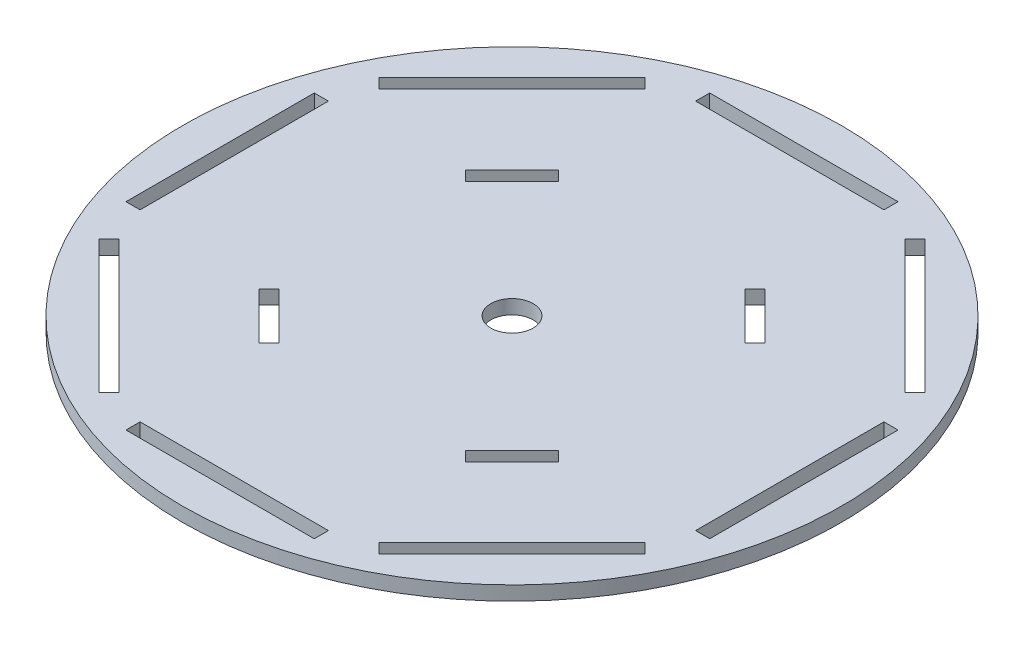
from build123d import *

# Parameters (mm, degrees)
CROQUIS1_R              = 70
CROQUIS1_R_2            = 4.5
SALIENTE_EXTRUIR1_DEPTH = 3


with BuildPart() as part:
    # Croquis1 → Saliente-Extruir1 (new body)
    with BuildSketch(Plane(origin=(0, 0, 0), x_dir=(1, 0, 0), z_dir=(0, 1, 0))):
        Circle(CROQUIS1_R)
        Circle(CROQUIS1_R_2, mode=Mode.SUBTRACT)
        Polygon((24.748737342, 24.748737342), (29.69848481, 19.798989873), (31.819805153, 21.920310217), (21.920310217, 31.819805153), (19.798989873, 29.69848481), align=None, mode=Mode.SUBTRACT)
        Polygon((24.748737342, -24.748737342), (19.798989873, -29.69848481), (21.920310217, -31.819805153), (31.819805153, -21.920310217), (29.69848481, -19.798989873), align=None, mode=Mode.SUBTRACT)
        Polygon((-24.748737342, 24.748737342), (-19.798989873, 29.69848481), (-21.920310217, 31.819805153), (-31.819805153, 21.920310217), (-29.69848481, 19.798989873), align=None, mode=Mode.SUBTRACT)
        Polygon((-24.748737342, -24.748737342), (-29.69848481, -19.798989873), (-31.819805153, -21.920310217), (-21.920310217, -31.819805153), (-19.798989873, -29.69848481), align=None, mode=Mode.SUBTRACT)
        Polygon((0, 62), (20, 62), (20, 59), (-20, 59), (-20, 62), align=None, mode=Mode.SUBTRACT)
        Polygon((55.861435714, 27.577164466), (27.577164466, 55.861435714), (29.69848481, 57.982756057), (43.840620434, 43.840620434), (57.982756057, 29.69848481), align=None, mode=Mode.SUBTRACT)
        Polygon((59, -20), (59, 20), (62, 20), (62, 0), (62, -20), align=None, mode=Mode.SUBTRACT)
        Polygon((27.577164466, -55.861435714), (55.861435714, -27.577164466), (57.982756057, -29.69848481), (43.840620434, -43.840620434), (29.69848481, -57.982756057), align=None, mode=Mode.SUBTRACT)
        Polygon((-20, -59), (20, -59), (20, -62), (0, -62), (-20, -62), align=None, mode=Mode.SUBTRACT)
        Polygon((-55.861435714, -27.577164466), (-27.577164466, -55.861435714), (-29.69848481, -57.982756057), (-43.840620434, -43.840620434), (-57.982756057, -29.69848481), align=None, mode=Mode.SUBTRACT)
        Polygon((-59, 20), (-59, -20), (-62, -20), (-62, 0), (-62, 20), align=None, mode=Mode.SUBTRACT)
        Polygon((-27.577164466, 55.861435714), (-55.861435714, 27.577164466), (-57.982756057, 29.69848481), (-43.840620434, 43.840620434), (-29.69848481, 57.982756057), align=None, mode=Mode.SUBTRACT)
    extrude(amount=SALIENTE_EXTRUIR1_DEPTH)


solid = part.part
